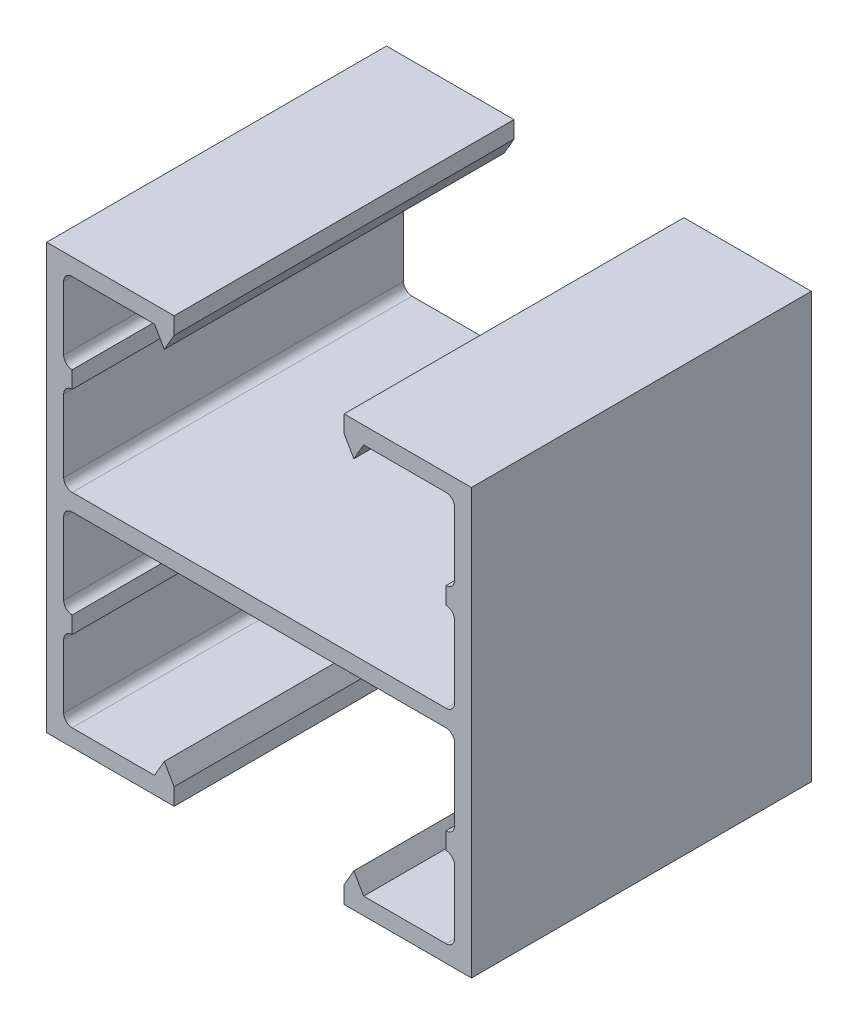
from build123d import *

# Parameters (mm, degrees)
BASE_EXTRUDE_DEPTH = 12.7
FILLET1_R          = 0.635


with BuildPart() as part:
    # Sketch1 → Base-Extrude (new, symmetric)
    with BuildSketch(Plane.XY):
        with BuildLine():
            Line((-6.35, 15.875), (-15.875, 15.875))
            Line((-15.875, 15.875), (-15.875, -15.875))
            Line((-15.875, -15.875), (-6.35, -15.875))
            Line((-6.35, -15.875), (-6.35, -14.605))
            Line((-6.35, -14.605), (-7.083234843, -13.335))
            Line((-7.083234843, -13.335), (-7.816469684, -14.605))
            Line((-7.816469684, -14.605), (-13.97, -14.605))
            ThreePointArc((-13.97, -14.605), (-14.419012806, -14.419012806), (-14.605, -13.97))
            Line((-14.605, -13.97), (-14.605, -8.5725))
            Line((-14.605, -8.5725), (-13.97, -8.5725))
            Line((-13.97, -8.5725), (-13.97, -7.3025))
            Line((-13.97, -7.3025), (-14.605, -7.3025))
            Line((-14.605, -7.3025), (-14.605, -1.27))
            ThreePointArc((-14.605, -1.27), (-14.419012806, -0.820987194), (-13.97, -0.635))
            Line((-13.97, -0.635), (13.97, -0.635))
            ThreePointArc((13.97, -0.635), (14.419012806, -0.820987194), (14.605, -1.27))
            Line((14.605, -1.27), (14.605, -7.3025))
            Line((14.605, -7.3025), (13.97, -7.3025))
            Line((13.97, -7.3025), (13.97, -8.5725))
            Line((13.97, -8.5725), (14.605, -8.5725))
            Line((14.605, -8.5725), (14.605, -13.97))
            ThreePointArc((14.605, -13.97), (14.419012806, -14.419012806), (13.97, -14.605))
            Line((13.97, -14.605), (7.816469684, -14.605))
            Line((7.816469684, -14.605), (7.083234843, -13.335))
            Line((7.083234843, -13.335), (6.35, -14.605))
            Line((6.35, -14.605), (6.35, -15.875))
            Line((6.35, -15.875), (15.875, -15.875))
            Line((15.875, -15.875), (15.875, 15.875))
            Line((15.875, 15.875), (6.35, 15.875))
            Line((6.35, 15.875), (6.35, 14.605))
            Line((6.35, 14.605), (7.083234843, 13.335))
            Line((7.083234843, 13.335), (7.816469684, 14.605))
            Line((7.816469684, 14.605), (13.97, 14.605))
            ThreePointArc((13.97, 14.605), (14.419012806, 14.419012806), (14.605, 13.97))
            Line((14.605, 13.97), (14.605, 8.5725))
            Line((14.605, 8.5725), (13.97, 8.5725))
            Line((13.97, 8.5725), (13.97, 7.3025))
            Line((13.97, 7.3025), (14.605, 7.3025))
            Line((14.605, 7.3025), (14.605, 1.27))
            ThreePointArc((14.605, 1.27), (14.419012806, 0.820987194), (13.97, 0.635))
            Line((13.97, 0.635), (-13.97, 0.635))
            ThreePointArc((-13.97, 0.635), (-14.419012806, 0.820987194), (-14.605, 1.27))
            Line((-14.605, 1.27), (-14.605, 7.3025))
            Line((-14.605, 7.3025), (-13.97, 7.3025))
            Line((-13.97, 7.3025), (-13.97, 8.5725))
            Line((-13.97, 8.5725), (-14.605, 8.5725))
            Line((-14.605, 8.5725), (-14.605, 13.97))
            ThreePointArc((-14.605, 13.97), (-14.419012806, 14.419012806), (-13.97, 14.605))
            Line((-13.97, 14.605), (-7.816469684, 14.605))
            Line((-7.816469684, 14.605), (-7.083234843, 13.335))
            Line((-7.083234843, 13.335), (-6.35, 14.605))
            Line((-6.35, 14.605), (-6.35, 15.875))
        make_face()
    extrude(amount=BASE_EXTRUDE_DEPTH, both=True)

    # Fillet1
    fillet1_edges = [part.edges().sort_by_distance(p)[0] for p in [
        (14.605, 8.5725, 0),
        (14.605, -7.3025, 0),
        (-14.605, 8.5725, 0),
        (-14.605, -7.3025, 0),
        (-14.605, 7.3025, 0),
        (-14.605, -8.5725, 0),
        (14.605, 7.3025, 0),
        (14.605, -8.5725, 0),
    ]]
    fillet(fillet1_edges, radius=FILLET1_R - 0.0001)  # a hair under: the kernel refuses the full size


solid = part.part
